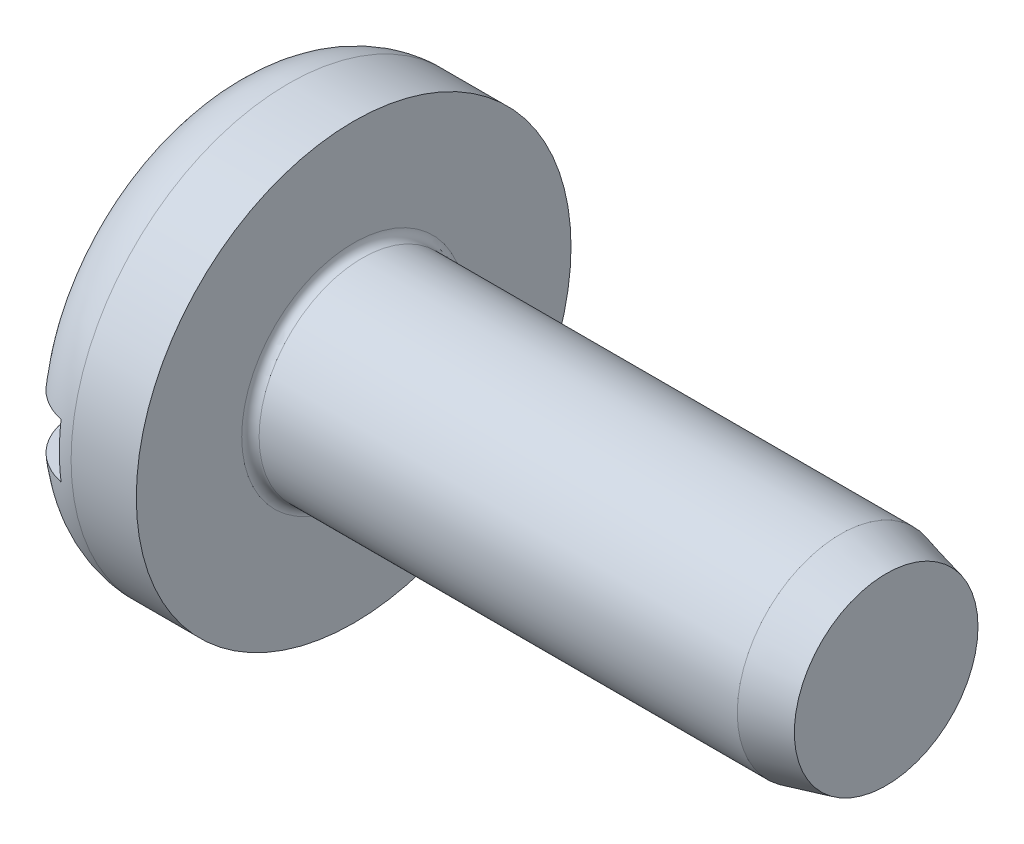
from build123d import *

# Parameters (mm, degrees)
SLOT_DEPTH      = 34.619190948
SLOT_DEPTH_BACK = 34.619190948
SKETCH2_W       = 2.4
SKETCH2_H       = 2.5
FILLET1_R       = 0.4


with BuildPart() as part:
    # Sketch1 → Base (revolve)
    with BuildSketch(Plane.XY):
        with BuildLine():
            Line((30.5, 0), (30.5, 4.75))
            Line((30.5, 4.75), (6, 4.75))
            Line((6, 4.75), (6, 10))
            Line((6, 10), (3, 10))
            ThreePointArc((3, 10), (0.878679656, 9.121320344), (0, 7))
            Line((0, 7), (0, 0))
            Line((0, 0), (30.5, 0))
        make_face()
    revolve(axis=Axis((-65.885195531, 0, 0), (1, 0, 0)))

    # Sketch2 → Slot (cut, two sides: drawn at the far end of the back side and taken through both)
    with BuildSketch(Plane.XY.offset(-SLOT_DEPTH_BACK)):
        with Locations((1.2, 0)):
            Rectangle(SKETCH2_W, SKETCH2_H)
    extrude(amount=SLOT_DEPTH + SLOT_DEPTH_BACK, mode=Mode.SUBTRACT)

    # Fillet1
    fillet1_edges = [part.edges().sort_by_distance(p)[0] for p in [
        (6, -4.75, 0),
    ]]
    fillet(fillet1_edges, radius=FILLET1_R)

    # Sketch3 → Cut-Revolve1 (revolve, cut)
    with BuildSketch(Plane.XY):
        Polygon((26.3, -4.75), (28.4, -4.75), (30.5, -4.225), (30.5, -5.25), (26.3, -5.25), align=None)
    revolve(axis=Axis((1.328193536, 0, 0), (-1, 0, 0)), mode=Mode.SUBTRACT)


solid = part.part
